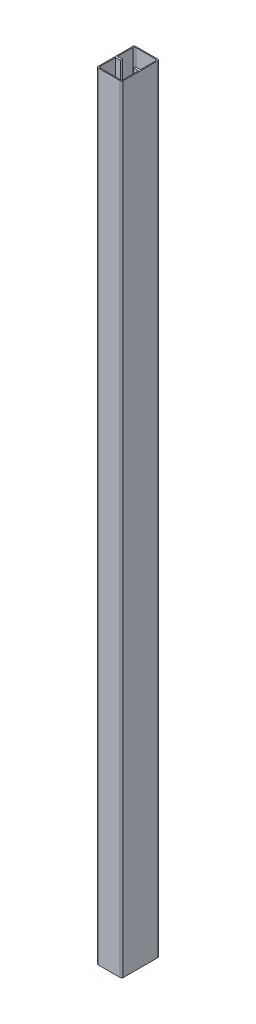
from build123d import *

# Parameters (mm, degrees)
ESBO_O1_W                = 100
ESBO_O1_H                = 150
RESSALTO_EXTRUS_O1_DEPTH = 3100
FILETE1_R                = 6


with BuildPart() as part:
    # Esboço1 → Ressalto-extrusão1 (new body)
    with BuildSketch(Plane(origin=(0, 0, 0), x_dir=(1, 0, 0), z_dir=(0, 1, 0))):
        Rectangle(ESBO_O1_W, ESBO_O1_H)
        Polygon((-46, 71), (-46, 4), (-26, 4), (-26, -4), (-46, -4), (-46, -71), (46, -71), (46, -4), (26, -4), (26, 4), (46, 4), (46, 71), align=None, mode=Mode.SUBTRACT)
    extrude(amount=RESSALTO_EXTRUS_O1_DEPTH)

    # Filete1
    filete1_edges = [part.edges().sort_by_distance(p)[0] for p in [
        (-50, 1550, -75),
        (50, 1550, 75),
        (46, 1550, 71),
        (-46, 1550, 71),
        (46, 1550, -71),
        (50, 1550, -75),
        (-50, 1550, 75),
        (-46, 1550, -71),
    ]]
    fillet(filete1_edges, radius=FILETE1_R)


solid = part.part
